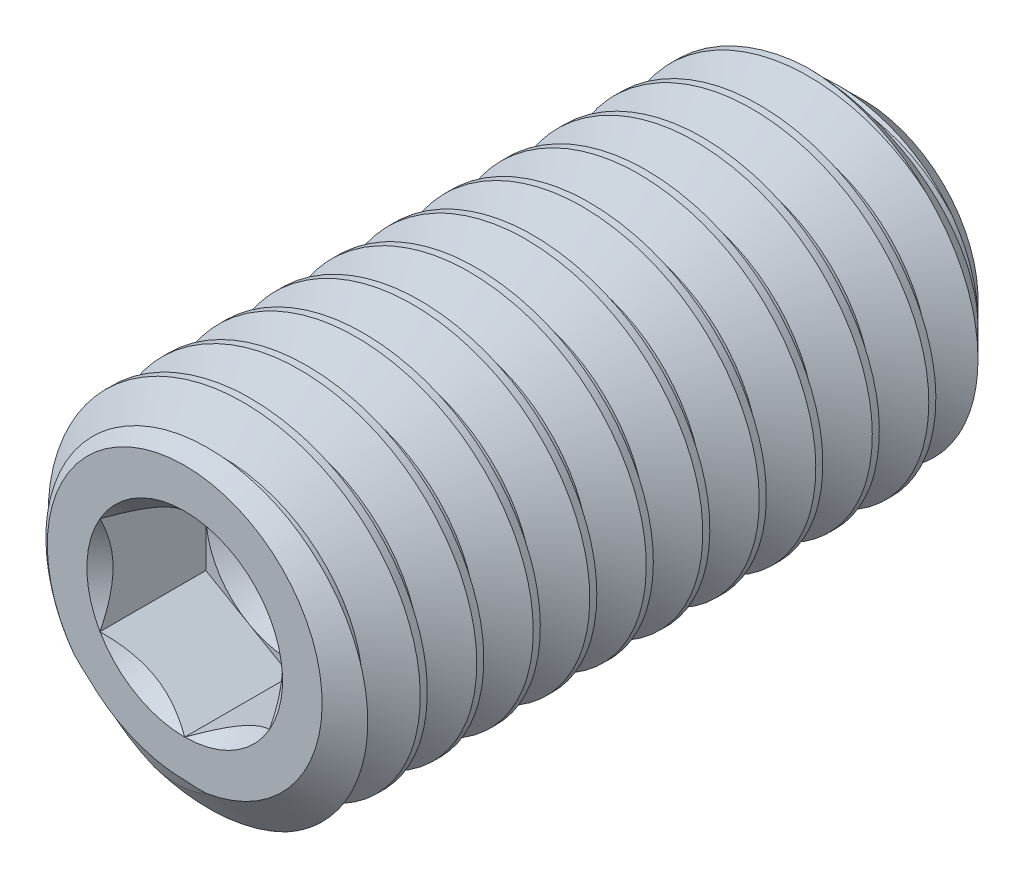
from build123d import *

# Parameters (mm, degrees)
CUT_SWEEP2_PITCH    = 0.79375
CUT_EXTRUDE10_DEPTH = 1.48828125


with BuildPart() as part:
    # Sketch22 → Revolve1 (revolve)
    with BuildSketch(Plane(origin=(0, 0, 0), x_dir=(0, 0, -1), z_dir=(1, 0, 0)), mode=Mode.PRIVATE) as revolve1_sk:
        Polygon((-4.7625, 0), (-4.7625, 1.9304), (-4.424579842, 2.413), (3.96875, 2.413), (4.7625, 1.61925), (4.7625, 0), align=None)
    revolve(revolve1_sk.sketch.rotate(Axis((0, 0, -4.7625), (0, 0, 1)), 90), axis=Axis((0, 0, -4.7625), (0, 0, 1)))

    # Cut-Sweep2: the profile of Sketch28 profile screwed along a right-hand helix of 13 turns, 8 arcs to a turn; built about Z, then put on its axis
    cut_sweep2_z = Axis((0, 0, 0), (0, 0, 1))
    cut_sweep2_corners = [(0, 2.4133, 0.000173205), (0, 2.4133, -0.694704455), (0, 1.897444252, -0.396875), (0, 1.897444252, -0.29765625)]
    with BuildLine(mode=Mode.PRIVATE) as cut_sweep2_profile:
        Line(cut_sweep2_corners[0], cut_sweep2_corners[1])
        Line(cut_sweep2_corners[1], cut_sweep2_corners[2])
        Line(cut_sweep2_corners[2], cut_sweep2_corners[3])
        Line(cut_sweep2_corners[3], cut_sweep2_corners[0])
    cut_sweep2_cap = Face(cut_sweep2_profile.wire())
    cut_sweep2_turn_angles = [0, 22.5, 45, 67.5, 90, 112.5, 135, 157.5, 180, 202.5, 225, 247.5, 270, 292.5, 315, 337.5, 360]
    cut_sweep2_turn_weights = [1, 0.9238795325112867, 1, 0.9238795325112867, 1, 0.9238795325112867, 1, 0.9238795325112867, 1, 0.9238795325112867, 1, 0.9238795325112867, 1, 0.9238795325112867, 1, 0.9238795325112867, 1]
    cut_sweep2_turn_rails = [Edge.make_bspline([Vector(p[0], p[1], 0).rotate(cut_sweep2_z, cut_sweep2_turn_angles[k]) / cut_sweep2_turn_weights[k] + Vector(0, 0, p[2] + CUT_SWEEP2_PITCH * cut_sweep2_turn_angles[k] / 360) for k in range(17)], [0, 0, 0, 1, 1, 2, 2, 3, 3, 4, 4, 5, 5, 6, 6, 7, 7, 8, 8, 8], 2, cut_sweep2_turn_weights) for p in cut_sweep2_corners]
    cut_sweep2_turn_sides = [Face.make_surface_from_curves(cut_sweep2_turn_rails[p[0]], cut_sweep2_turn_rails[p[1]]) for p in [(0, 1), (1, 2), (2, 3), (3, 0)]]
    cut_sweep2 = Plane(origin=(0, 0, -4.7625), x_dir=(1, 0, 0), z_dir=(0, 0, 1)) * Solid(Shell([*[p.moved(Location((0, 0, CUT_SWEEP2_PITCH * i))) for i in range(13) for p in cut_sweep2_turn_sides], cut_sweep2_cap, cut_sweep2_cap.rotate(cut_sweep2_z, 4680).moved(Location((0, 0, CUT_SWEEP2_PITCH * 4680 / 360)))]))
    add(cut_sweep2, mode=Mode.SUBTRACT)

    # Sketch23 → Cut-Extrude10 (cut)
    with BuildSketch(Plane.XY.offset(4.7625)):
        Polygon((0, 1.374815329), (-1.190625, 0.687407664), (-1.190625, -0.687407664), (0, -1.374815329), (1.190625, -0.687407664), (1.190625, 0.687407664), align=None)
    extrude(amount=-CUT_EXTRUDE10_DEPTH, mode=Mode.SUBTRACT)

    # Cut-Extrude11 cone 1 section (through the dimple's axis) → Cut-Extrude11 (revolve, cut)
    with BuildSketch(Plane(origin=(0, 0, 4.7625), x_dir=(0, -1, 0), z_dir=(1, 0, 0))):
        Polygon((0, 0), (1.374815329, 0), (0, 1.374815329), align=None)
    revolve(axis=Axis((0, 0, 4.7625), (0, 0, -1)), mode=Mode.SUBTRACT)

    # Cut-Extrude12 cone 1 section (through the dimple's axis) → Cut-Extrude12 (revolve, cut)
    with BuildSketch(Plane(origin=(0, 0, 3.27421875), x_dir=(0, -1, 0), z_dir=(1, 0, 0))):
        Polygon((0, 0), (1.190625, 0), (0, 0.687407664), align=None)
    revolve(axis=Axis((0, 0, 3.27421875), (0, 0, -1)), mode=Mode.SUBTRACT)


solid = part.part
